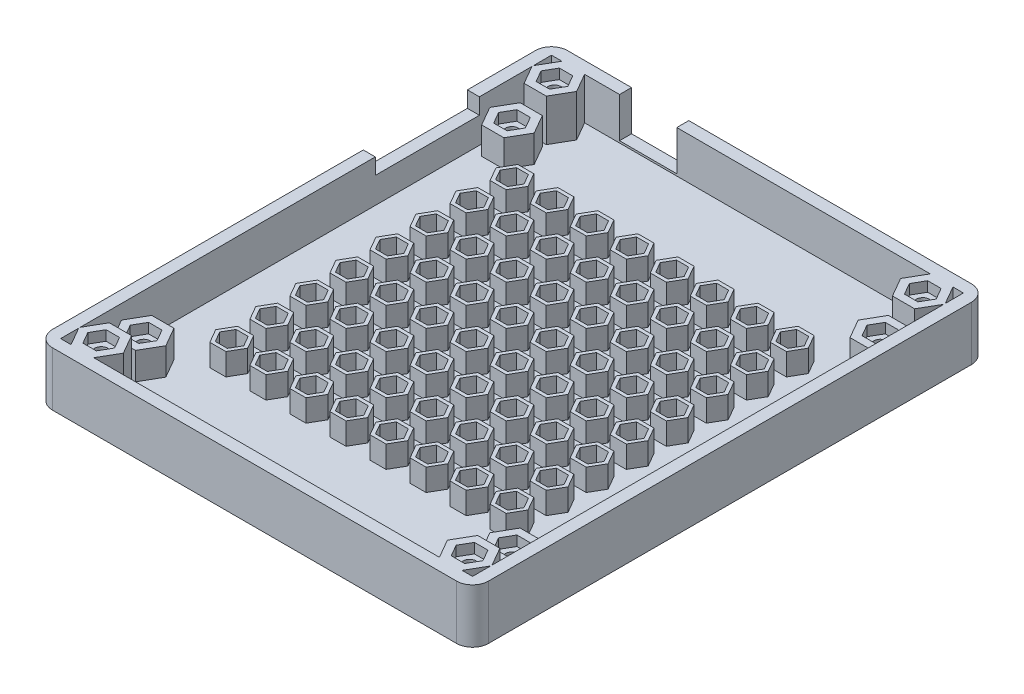
from build123d import *

# Parameters (mm, degrees)
P_IDAT_VYSUNUT_M25_DEPTH      = 3
P_IDAT_VYSUNUT_M26_DEPTH      = 10.5
P_IDAT_VYSUNUT_M26_DEPTH_BACK = 3
SKICA1_21_W                   = 108.885125168
SKICA1_21_H                   = 128.6
SKICA1_21_W_2                 = 102.885125168
SKICA1_21_H_2                 = 122.6
P_IDAT_VYSUNUT_M28_DEPTH      = 6.8
SKICA1_24_R                   = 1.6
P_IDAT_VYSUNUT_M29_DEPTH      = 4.3
LINPOLE3_COUNT                = 2
LINPOLE3_PITCH                = 92
LINPOLE3_COUNT_DIR2           = 2
LINPOLE3_PITCH_DIR2           = 92
P_IDAT_VYSUNUT_M30_DEPTH      = 10.5
SKICA1_26_R                   = 1.6
P_IDAT_VYSUNUT_M31_DEPTH      = 8
LINPOLE4_COUNT                = 2
LINPOLE4_PITCH                = 92
LINPOLE4_COUNT_DIR2           = 2
LINPOLE4_PITCH_DIR2           = 113.2
ZAOBLIT4_R                    = 4
SKICA9_W                      = 26
SKICA9_H                      = 4
ODEBRAT_VYSUNUT_M1_DEPTH      = 4
SKICA10_W                     = 14.3
SKICA10_H                     = 10
ODEBRAT_VYSUNUT_M2_DEPTH      = 5
P_IDAT_VYSUNUT_M32_DEPTH      = 5.5
LINPOLE5_COUNT                = 8
LINPOLE5_PITCH                = 10
LINPOLE5_COUNT_DIR2           = 8
LINPOLE5_PITCH_DIR2           = 10


with BuildPart() as part:
    # Skica1 → Přidat vysunutím25 (new body)
    with BuildSketch(Plane(origin=(0, 0, 0), x_dir=(1, 0, 0), z_dir=(0, 1, 0))):
        Polygon((51.442562584, 61.3), (-43.170983681, 61.3), (-43.228718708, 61.4), (-48.771281292, 61.4), (-48.829016319, 61.3), (-51.442562584, 61.3), (-51.442562584, 56.773205081), (-51.542562584, 56.6), (-51.442562584, 56.426794919), (-51.442562584, 46.173205081), (-51.542562584, 46), (-51.442562584, 45.826794919), (-51.442562584, -61.3), (51.442562584, -61.3), align=None)
    extrude(amount=-P_IDAT_VYSUNUT_M25_DEPTH)

    # Skica1<21> → Přidat vysunutím26 (add, two sides: drawn at the far end of the back side and taken through both)
    with BuildSketch(Plane(origin=(0, 0, 0), x_dir=(1, 0, 0), z_dir=(0, 1, 0)).offset(-P_IDAT_VYSUNUT_M26_DEPTH_BACK)):
        Rectangle(SKICA1_21_W, SKICA1_21_H)
        Rectangle(SKICA1_21_W_2, SKICA1_21_H_2, mode=Mode.SUBTRACT)
    extrude(amount=P_IDAT_VYSUNUT_M26_DEPTH + P_IDAT_VYSUNUT_M26_DEPTH_BACK)

    # Skica1<23> → Přidat vysunutím28 (add)
    with BuildSketch(Plane(origin=(0, 0, 0), x_dir=(1, 0, 0), z_dir=(0, 1, 0))):
        Polygon((-48.771281292, 41.2), (-43.228718708, 41.2), (-40.457437416, 46), (-43.228718708, 50.8), (-48.771281292, 50.8), (-51.542562584, 46), align=None)
        Polygon((-44.325684219, 43.1), (-47.674315781, 43.1), (-49.348631561, 46), (-47.674315781, 48.9), (-44.325684219, 48.9), (-42.651368439, 46), align=None, mode=Mode.SUBTRACT)
    p_idat_vysunut_m28 = extrude(amount=P_IDAT_VYSUNUT_M28_DEPTH)

    # Skica1<24> → Přidat vysunutím29 (add)
    with BuildSketch(Plane(origin=(0, 0, 0), x_dir=(1, 0, 0), z_dir=(0, 1, 0))):
        Polygon((-49.348631561, 46), (-47.674315781, 43.1), (-44.325684219, 43.1), (-42.651368439, 46), (-44.325684219, 48.9), (-47.674315781, 48.9), align=None)
        with Locations((-46, 46)):
            Circle(SKICA1_24_R, mode=Mode.SUBTRACT)
    p_idat_vysunut_m29 = extrude(amount=P_IDAT_VYSUNUT_M29_DEPTH)

    # LinPole3: Přidat vysunutím28, P_idat vysunut_m29 2 × 2
    with Locations(*[(i * LINPOLE3_PITCH, 0, j * LINPOLE3_PITCH_DIR2) for i in range(LINPOLE3_COUNT) for j in range(LINPOLE3_COUNT_DIR2) if (i, j) != (0, 0)]):
        add(p_idat_vysunut_m28)
        add(p_idat_vysunut_m29)

    # Skica1<25> → Přidat vysunutím30 (add)
    with BuildSketch(Plane(origin=(0, 0, 0), x_dir=(1, 0, 0), z_dir=(0, 1, 0))):
        Polygon((-51.542562584, 56.6), (-48.771281292, 51.8), (-43.228718708, 51.8), (-40.457437416, 56.6), (-43.228718708, 61.4), (-48.771281292, 61.4), align=None)
        Polygon((-44.325684219, 59.5), (-42.651368439, 56.6), (-44.325684219, 53.7), (-47.674315781, 53.7), (-49.348631561, 56.6), (-47.674315781, 59.5), align=None, mode=Mode.SUBTRACT)
    p_idat_vysunut_m30 = extrude(amount=P_IDAT_VYSUNUT_M30_DEPTH)

    # Skica1<26> → Přidat vysunutím31 (add)
    with BuildSketch(Plane(origin=(0, 0, 0), x_dir=(1, 0, 0), z_dir=(0, 1, 0))):
        Polygon((-44.325684219, 53.7), (-42.651368439, 56.6), (-44.325684219, 59.5), (-47.674315781, 59.5), (-49.348631561, 56.6), (-47.674315781, 53.7), align=None)
        with Locations((-46, 56.6)):
            Circle(SKICA1_26_R, mode=Mode.SUBTRACT)
    p_idat_vysunut_m31 = extrude(amount=P_IDAT_VYSUNUT_M31_DEPTH)

    # LinPole4: Přidat vysunutím30, P_idat vysunut_m31 2 × 2
    with Locations(*[(i * LINPOLE4_PITCH, 0, j * LINPOLE4_PITCH_DIR2) for i in range(LINPOLE4_COUNT) for j in range(LINPOLE4_COUNT_DIR2) if (i, j) != (0, 0)]):
        add(p_idat_vysunut_m30)
        add(p_idat_vysunut_m31)

    # Zaoblit4
    zaoblit4_edges = [part.edges().sort_by_distance(p)[0] for p in [
        (-54.442562584, 3.75, 64.3),
        (54.442562584, 3.75, 64.3),
        (54.442562584, 3.75, -64.3),
        (-54.442562584, 3.75, -64.3),
    ]]
    fillet(zaoblit4_edges, radius=ZAOBLIT4_R)

    # Skica9 → Odebrat vysunutím1 (cut)
    with BuildSketch(Plane.ZY.offset(54.442562584)):
        with Locations((-30.3, 8.5)):
            Rectangle(SKICA9_W, SKICA9_H)
    extrude(amount=-ODEBRAT_VYSUNUT_M1_DEPTH, mode=Mode.SUBTRACT)

    # Skica10 → Odebrat vysunutím2 (cut)
    with BuildSketch(Plane(origin=(0, 0, -64.3), x_dir=(-1, 0, 0), z_dir=(0, 0, -1))):
        with Locations((27.292562584, 5.5)):
            Rectangle(SKICA10_W, SKICA10_H)
    extrude(amount=-ODEBRAT_VYSUNUT_M2_DEPTH, mode=Mode.SUBTRACT)

    # Skica11 → Přidat vysunutím32 (add)
    with BuildSketch(Plane(origin=(0, 0, 0), x_dir=(1, 0, 0), z_dir=(0, 1, 0))):
        Polygon((-33, 31.535898385), (-31, 35), (-33, 38.464101615), (-37, 38.464101615), (-39, 35), (-37, 31.535898385), align=None)
        Polygon((-33.5, 32.401923789), (-32, 35), (-33.5, 37.598076211), (-36.5, 37.598076211), (-38, 35), (-36.5, 32.401923789), align=None, mode=Mode.SUBTRACT)
    p_idat_vysunut_m32 = extrude(amount=P_IDAT_VYSUNUT_M32_DEPTH)

    # LinPole5: P_idat vysunut_m32 8 × 8
    with Locations(*[(i * LINPOLE5_PITCH, 0, j * LINPOLE5_PITCH_DIR2) for i in range(LINPOLE5_COUNT) for j in range(LINPOLE5_COUNT_DIR2) if (i, j) != (0, 0)]):
        add(p_idat_vysunut_m32)


solid = part.part
